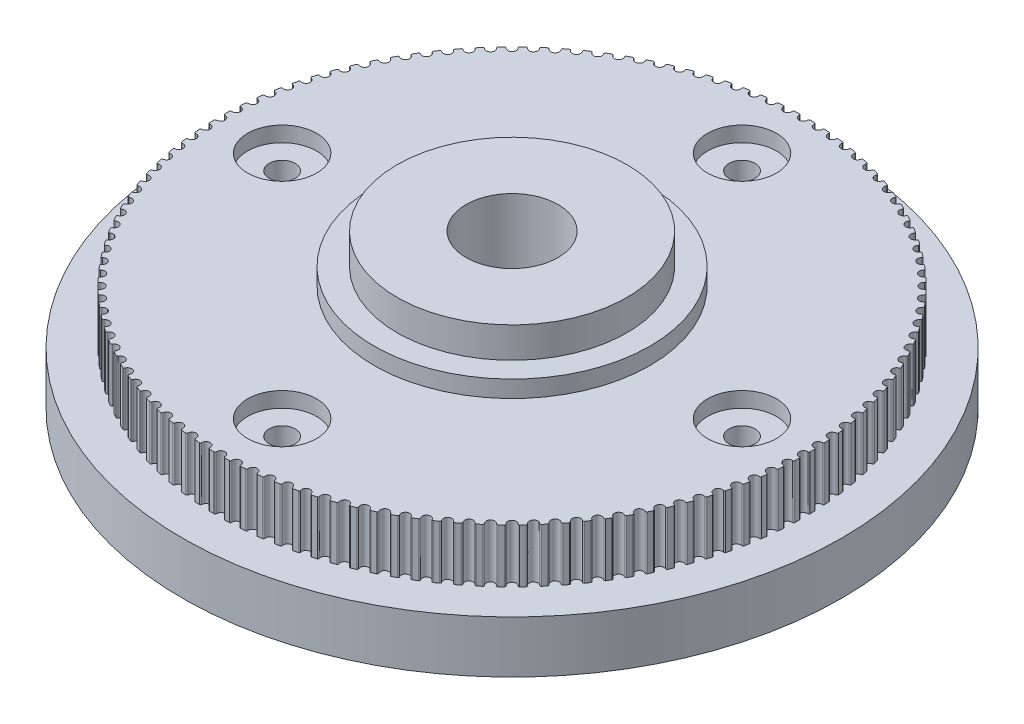
from build123d import *

# Parameters (mm, degrees)
CUT_EXTRUDE1_START      = -11
CUT_EXTRUDE1_DEPTH      = 7
SKETCH2_R               = 43
BOSS_EXTRUDE1_DEPTH     = 3
SKETCH3_R               = 43
SKETCH3_R_2             = 40
BOSS_EXTRUDE2_DEPTH     = 3.8
CUT_EXTRUDE2_DEPTH      = 63.357357224
CUT_EXTRUDE2_DEPTH_BACK = 63.357357224
SKETCH4_R               = 1.7
SKETCH10_R              = 4.5
CUT_EXTRUDE3_DEPTH      = 2
SKETCH5_R               = 18
BOSS_EXTRUDE3_DEPTH     = 2.2
SKETCH6_R               = 15
BOSS_EXTRUDE4_DEPTH     = 4
CUT_EXTRUDE4_REACH      = 66.016
SKETCH11_R              = 6


with BuildPart() as part:
    # Cut-Extrude1: read off the stored shape, not the designer's step
    # Cut-Extrude1 outline → Cut-Extrude1 (new body)
    with BuildSketch(Plane.XZ.offset(CUT_EXTRUDE1_START)):
        with BuildLine():
            ThreePointArc((-3.424251193, -37.883140987), (-3.393914308, -37.998585315), (-3.288901384, -38.055330404))
            ThreePointArc((-3.288901384, -38.055330404), (-2.9969167, -38.079437164), (-2.704755703, -38.101303666))
            ThreePointArc((-2.704755703, -38.101303666), (-2.592158775, -38.061684843), (-2.544135916, -37.952407562))
            ThreePointArc((-2.544135916, -37.952407562), (-1.960095985, -37.400859422), (-1.436907966, -38.01043492))
            ThreePointArc((-1.436907966, -38.01043492), (-1.400570768, -38.124133325), (-1.292731952, -38.175304695))
            ThreePointArc((-1.292731952, -38.175304695), (-0.999885772, -38.18409712), (-0.706980768, -38.190643129))
            ThreePointArc((-0.706980768, -38.190643129), (-0.596611639, -38.145185735), (-0.554373725, -38.033544892))
            ThreePointArc((-0.554373725, -38.033544892), (0, -37.452186342), (0.554373725, -38.033544892))
            ThreePointArc((0.554373725, -38.033544892), (0.596611639, -38.145185735), (0.706980768, -38.190643129))
            ThreePointArc((0.706980768, -38.190643129), (0.999885772, -38.18409712), (1.292731952, -38.175304695))
            ThreePointArc((1.292731952, -38.175304695), (1.400570768, -38.124133325), (1.436907966, -38.01043492))
            ThreePointArc((1.436907966, -38.01043492), (1.960095985, -37.400859422), (2.544135916, -37.952407562))
            ThreePointArc((2.544135916, -37.952407562), (2.592158775, -38.061684843), (2.704755703, -38.101303666))
            ThreePointArc((2.704755703, -38.101303666), (2.9969167, -38.079437164), (3.288901384, -38.055330404))
            ThreePointArc((3.288901384, -38.055330404), (3.393914308, -37.998585315), (3.424251193, -37.883140987))
            ThreePointArc((3.424251193, -37.883140987), (3.914819485, -37.247019347), (4.526924808, -37.76724532))
            ThreePointArc((4.526924808, -37.76724532), (4.580600984, -37.873859519), (4.695117091, -37.907531177))
            ThreePointArc((4.695117091, -37.907531177), (4.985733287, -37.870404118), (5.276056166, -37.831049097))
            ThreePointArc((5.276056166, -37.831049097), (5.377955364, -37.768885823), (5.402208784, -37.652011999))
            ThreePointArc((5.402208784, -37.652011999), (5.858812734, -36.99108778), (6.497305713, -37.478565684))
            ThreePointArc((6.497305713, -37.478565684), (6.556488084, -37.582224578), (6.672609489, -37.609856781))
            ThreePointArc((6.672609489, -37.609856781), (6.960884325, -37.557570926), (7.248749644, -37.503075514))
            ThreePointArc((7.248749644, -37.503075514), (7.347255819, -37.435664441), (7.365359297, -37.317681462))
            ThreePointArc((7.365359297, -37.317681462), (7.786747387, -36.633766213), (8.449877955, -37.087159905))
            ThreePointArc((8.449877955, -37.087159905), (8.514404306, -37.187579372), (8.631812729, -37.209096381))
            ThreePointArc((8.631812729, -37.209096381), (8.916956064, -37.141795043), (9.201574804, -37.072308609))
            ThreePointArc((9.201574804, -37.072308609), (9.296417957, -36.999834505), (9.308321873, -36.881065755))
            ThreePointArc((9.308321873, -36.881065755), (9.693339106, -36.176034039), (10.379289669, -36.594100799))
            ThreePointArc((10.379289669, -36.594100799), (10.448983138, -36.691005596), (10.567356769, -36.706348434))
            ThreePointArc((10.567356769, -36.706348434), (10.848587046, -36.624216081), (11.129179087, -36.539929082))
            ThreePointArc((11.129179087, -36.539929082), (11.220099259, -36.462590595), (11.225770984, -36.34336161))
            ThreePointArc((11.225770984, -36.34336161), (11.573362056, -35.61914587), (12.280252472, -36.000739805))
            ThreePointArc((12.280252472, -36.000739805), (12.354922033, -36.093864323), (12.47393642, -36.102990938))
            ThreePointArc((12.47393642, -36.102990938), (12.750482805, -36.006252689), (13.026279063, -35.907396149))
            ThreePointArc((13.026279063, -35.907396149), (13.113027048, -35.825405258), (13.112451038, -35.706042837))
            ThreePointArc((13.112451038, -35.706042837), (13.421663225, -34.964628098), (14.147555955, -35.308703287))
            ThreePointArc((14.147555955, -35.308703287), (14.226996946, -35.397792278), (14.346325877, -35.400677653))
            ThreePointArc((14.346325877, -35.400677653), (14.617430376, -35.289598661), (14.887674914, -35.17644354))
            ThreePointArc((14.887674914, -35.17644354), (14.970012942, -35.090024975), (14.963190776, -34.970856282))
            ThreePointArc((14.963190776, -34.970856282), (15.233176549, -34.214274712), (15.976081972, -34.519888066))
            ThreePointArc((15.976081972, -34.519888066), (16.060076649, -34.604697344), (16.179393053, -34.601333571))
            ThreePointArc((16.179393053, -34.601333571), (16.444312587, -34.476218296), (16.708264683, -34.349074744))
            ThreePointArc((16.708264683, -34.349074744), (16.785967072, -34.258465373), (16.772917447, -34.139817041))
            ThreePointArc((16.772917447, -34.139817041), (17.002936794, -33.370142376), (17.760818658, -33.636456233))
            ThreePointArc((17.760818658, -33.636456233), (17.849136798, -33.71675334), (17.968113637, -33.707149639))
            ThreePointArc((17.968113637, -33.707149639), (18.22612208, -33.568341013), (18.483058259, -33.427557521))
            ThreePointArc((18.483058259, -33.427557521), (18.555912032, -33.333005699), (18.536670717, -33.215202935))
            ThreePointArc((18.536670717, -33.215202935), (18.726093171, -32.434544799), (19.496874175, -32.66082921))
            ThreePointArc((19.496874175, -32.66082921), (19.589273704, -32.736394059), (19.70758487, -32.720576753))
            ThreePointArc((19.70758487, -32.720576753), (19.95797504, -32.568455241), (20.207191058, -32.414417687))
            ThreePointArc((20.207191058, -32.414417687), (20.274996527, -32.316182573), (20.249616262, -32.199548266))
            ThreePointArc((20.249616262, -32.199548266), (20.397922629, -31.41004639), (21.179490115, -31.595681125))
            ThreePointArc((21.179490115, -31.595681125), (21.275717772, -31.666306598), (21.393038983, -31.64431904))
            ThreePointArc((21.393038983, -31.64431904), (21.635124577, -31.479301596), (21.875937351, -31.312432187))
            ThreePointArc((21.875937351, -31.312432187), (21.938508666, -31.210783036), (21.907059015, -31.095636874))
            ThreePointArc((21.907059015, -31.095636874), (22.013842798, -30.299455227), (22.804054545, -30.443931474))
            ThreePointArc((22.804054545, -30.443931474), (22.903846576, -30.509423991), (23.019856263, -30.481326449))
            ThreePointArc((23.019856263, -30.481326449), (23.252973742, -30.303865374), (23.48472322, -30.124621487))
            ThreePointArc((23.48472322, -30.124621487), (23.541888878, -30.019836913), (23.504456043, -29.906494502))
            ThreePointArc((23.504456043, -29.906494502), (23.569424554, -29.105815363), (24.366114646, -29.208737123))
            ThreePointArc((24.366114646, -29.208737123), (24.46919753, -29.268917173), (24.583577718, -29.23478666))
            ThreePointArc((24.583577718, -29.23478666), (24.807088122, -29.045368364), (25.029139095, -28.854241294))
            ThreePointArc((25.029139095, -28.854241294), (25.080742408, -28.746608504), (25.037428991, -28.635380508))
            ThreePointArc((25.037428991, -28.635380508), (25.060404157, -27.832398483), (25.861388921, -27.893483654))
            ThreePointArc((25.861388921, -27.893483654), (25.967480113, -27.948186288), (26.079917294, -27.908116353))
            ThreePointArc((26.079917294, -27.908116353), (26.293207997, -27.707260017), (26.504951839, -27.50477363))
            ThreePointArc((26.504951839, -27.50477363), (26.550851367, -27.394587639), (26.501776086, -27.285778926))
            ThreePointArc((26.501776086, -27.285778926), (26.482694933, -26.482694933), (27.285778926, -26.501776086))
            ThreePointArc((27.285778926, -26.501776086), (27.394587639, -26.550851367), (27.50477363, -26.504951839))
            ThreePointArc((27.50477363, -26.504951839), (27.707260017, -26.293207997), (27.908116353, -26.079917294))
            ThreePointArc((27.908116353, -26.079917294), (27.948186288, -25.967480113), (27.893483654, -25.861388921))
            ThreePointArc((27.893483654, -25.861388921), (27.832398483, -25.060404157), (28.635380508, -25.037428991))
            ThreePointArc((28.635380508, -25.037428991), (28.746608504, -25.080742408), (28.854241294, -25.029139095))
            ThreePointArc((28.854241294, -25.029139095), (29.045368364, -24.807088122), (29.23478666, -24.583577718))
            ThreePointArc((29.23478666, -24.583577718), (29.268917173, -24.46919753), (29.208737123, -24.366114646))
            ThreePointArc((29.208737123, -24.366114646), (29.105815363, -23.569424554), (29.906494502, -23.504456043))
            ThreePointArc((29.906494502, -23.504456043), (30.019836913, -23.541888878), (30.124621487, -23.48472322))
            ThreePointArc((30.124621487, -23.48472322), (30.303865374, -23.252973742), (30.481326449, -23.019856263))
            ThreePointArc((30.481326449, -23.019856263), (30.509423991, -22.903846576), (30.443931474, -22.804054545))
            ThreePointArc((30.443931474, -22.804054545), (30.299455227, -22.013842798), (31.095636874, -21.907059015))
            ThreePointArc((31.095636874, -21.907059015), (31.210783036, -21.938508666), (31.312432187, -21.875937351))
            ThreePointArc((31.312432187, -21.875937351), (31.479301596, -21.635124577), (31.64431904, -21.393038983))
            ThreePointArc((31.64431904, -21.393038983), (31.666306598, -21.275717772), (31.595681125, -21.179490115))
            ThreePointArc((31.595681125, -21.179490115), (31.41004639, -20.397922629), (32.199548266, -20.249616262))
            ThreePointArc((32.199548266, -20.249616262), (32.316182573, -20.274996527), (32.414417687, -20.207191058))
            ThreePointArc((32.414417687, -20.207191058), (32.568455241, -19.95797504), (32.720576753, -19.70758487))
            ThreePointArc((32.720576753, -19.70758487), (32.736394059, -19.589273704), (32.66082921, -19.496874175))
            ThreePointArc((32.66082921, -19.496874175), (32.434544799, -18.726093171), (33.215202935, -18.536670717))
            ThreePointArc((33.215202935, -18.536670717), (33.333005699, -18.555912032), (33.427557521, -18.483058259))
            ThreePointArc((33.427557521, -18.483058259), (33.568341013, -18.22612208), (33.707149639, -17.968113637))
            ThreePointArc((33.707149639, -17.968113637), (33.71675334, -17.849136798), (33.636456233, -17.760818658))
            ThreePointArc((33.636456233, -17.760818658), (33.370142376, -17.002936794), (34.139817041, -16.772917447))
            ThreePointArc((34.139817041, -16.772917447), (34.258465373, -16.785967072), (34.349074744, -16.708264683))
            ThreePointArc((34.349074744, -16.708264683), (34.476218296, -16.444312587), (34.601333571, -16.179393053))
            ThreePointArc((34.601333571, -16.179393053), (34.604697344, -16.060076649), (34.519888066, -15.976081972))
            ThreePointArc((34.519888066, -15.976081972), (34.214274712, -15.233176549), (34.970856282, -14.963190776))
            ThreePointArc((34.970856282, -14.963190776), (35.090024975, -14.970012942), (35.17644354, -14.887674914))
            ThreePointArc((35.17644354, -14.887674914), (35.289598661, -14.617430376), (35.400677653, -14.346325877))
            ThreePointArc((35.400677653, -14.346325877), (35.397792278, -14.226996946), (35.308703287, -14.147555955))
            ThreePointArc((35.308703287, -14.147555955), (34.964628098, -13.421663225), (35.706042837, -13.112451038))
            ThreePointArc((35.706042837, -13.112451038), (35.825405258, -13.113027048), (35.907396149, -13.026279063))
            ThreePointArc((35.907396149, -13.026279063), (36.006252689, -12.750482805), (36.102990938, -12.47393642))
            ThreePointArc((36.102990938, -12.47393642), (36.093864323, -12.354922033), (36.000739805, -12.280252472))
            ThreePointArc((36.000739805, -12.280252472), (35.61914587, -11.573362056), (36.34336161, -11.225770984))
            ThreePointArc((36.34336161, -11.225770984), (36.462590595, -11.220099259), (36.539929082, -11.129179087))
            ThreePointArc((36.539929082, -11.129179087), (36.624216081, -10.848587046), (36.706348434, -10.567356769))
            ThreePointArc((36.706348434, -10.567356769), (36.691005596, -10.448983138), (36.594100799, -10.379289669))
            ThreePointArc((36.594100799, -10.379289669), (36.176034039, -9.693339106), (36.881065755, -9.308321873))
            ThreePointArc((36.881065755, -9.308321873), (36.999834505, -9.296417957), (37.072308609, -9.201574804))
            ThreePointArc((37.072308609, -9.201574804), (37.141795043, -8.916956064), (37.209096381, -8.631812729))
            ThreePointArc((37.209096381, -8.631812729), (37.187579372, -8.514404306), (37.087159905, -8.449877955))
            ThreePointArc((37.087159905, -8.449877955), (36.633766213, -7.786747387), (37.317681462, -7.365359297))
            ThreePointArc((37.317681462, -7.365359297), (37.435664441, -7.347255819), (37.503075514, -7.248749644))
            ThreePointArc((37.503075514, -7.248749644), (37.557570926, -6.960884325), (37.609856781, -6.672609489))
            ThreePointArc((37.609856781, -6.672609489), (37.582224578, -6.556488084), (37.478565684, -6.497305713))
            ThreePointArc((37.478565684, -6.497305713), (36.99108778, -5.858812734), (37.652011999, -5.402208784))
            ThreePointArc((37.652011999, -5.402208784), (37.768885823, -5.377955364), (37.831049097, -5.276056166))
            ThreePointArc((37.831049097, -5.276056166), (37.870404118, -4.985733287), (37.907531177, -4.695117091))
            ThreePointArc((37.907531177, -4.695117091), (37.873859519, -4.580600984), (37.76724532, -4.526924808))
            ThreePointArc((37.76724532, -4.526924808), (37.247019347, -3.914819485), (37.883140987, -3.424251193))
            ThreePointArc((37.883140987, -3.424251193), (37.998585315, -3.393914308), (38.055330404, -3.288901384))
            ThreePointArc((38.055330404, -3.288901384), (38.079437164, -2.9969167), (38.101303666, -2.704755703))
            ThreePointArc((38.101303666, -2.704755703), (38.061684843, -2.592158775), (37.952407562, -2.544135916))
            ThreePointArc((37.952407562, -2.544135916), (37.400859422, -1.960095985), (38.01043492, -1.436907966))
            ThreePointArc((38.01043492, -1.436907966), (38.124133325, -1.400570768), (38.175304695, -1.292731952))
            ThreePointArc((38.175304695, -1.292731952), (38.18409712, -0.999885772), (38.190643129, -0.706980768))
            ThreePointArc((38.190643129, -0.706980768), (38.145185735, -0.596611639), (38.033544892, -0.554373725))
            ThreePointArc((38.033544892, -0.554373725), (37.452186342, 0), (38.033544892, 0.554373725))
            ThreePointArc((38.033544892, 0.554373725), (38.145185735, 0.596611639), (38.190643129, 0.706980768))
            ThreePointArc((38.190643129, 0.706980768), (38.18409712, 0.999885772), (38.175304695, 1.292731952))
            ThreePointArc((38.175304695, 1.292731952), (38.124133325, 1.400570768), (38.01043492, 1.436907966))
            ThreePointArc((38.01043492, 1.436907966), (37.400859422, 1.960095985), (37.952407562, 2.544135916))
            ThreePointArc((37.952407562, 2.544135916), (38.061684843, 2.592158775), (38.101303666, 2.704755703))
            ThreePointArc((38.101303666, 2.704755703), (38.079437164, 2.9969167), (38.055330404, 3.288901384))
            ThreePointArc((38.055330404, 3.288901384), (37.998585315, 3.393914308), (37.883140987, 3.424251193))
            ThreePointArc((37.883140987, 3.424251193), (37.247019347, 3.914819485), (37.76724532, 4.526924808))
            ThreePointArc((37.76724532, 4.526924808), (37.873859519, 4.580600984), (37.907531177, 4.695117091))
            ThreePointArc((37.907531177, 4.695117091), (37.870404118, 4.985733287), (37.831049097, 5.276056166))
            ThreePointArc((37.831049097, 5.276056166), (37.768885823, 5.377955364), (37.652011999, 5.402208784))
            ThreePointArc((37.652011999, 5.402208784), (36.99108778, 5.858812734), (37.478565684, 6.497305713))
            ThreePointArc((37.478565684, 6.497305713), (37.582224578, 6.556488084), (37.609856781, 6.672609489))
            ThreePointArc((37.609856781, 6.672609489), (37.557570926, 6.960884325), (37.503075514, 7.248749644))
            ThreePointArc((37.503075514, 7.248749644), (37.435664441, 7.347255819), (37.317681462, 7.365359297))
            ThreePointArc((37.317681462, 7.365359297), (36.633766213, 7.786747387), (37.087159905, 8.449877955))
            ThreePointArc((37.087159905, 8.449877955), (37.187579372, 8.514404306), (37.209096381, 8.631812729))
            ThreePointArc((37.209096381, 8.631812729), (37.141795043, 8.916956064), (37.072308609, 9.201574804))
            ThreePointArc((37.072308609, 9.201574804), (36.999834505, 9.296417957), (36.881065755, 9.308321873))
            ThreePointArc((36.881065755, 9.308321873), (36.176034039, 9.693339106), (36.594100799, 10.379289669))
            ThreePointArc((36.594100799, 10.379289669), (36.691005596, 10.448983138), (36.706348434, 10.567356769))
            ThreePointArc((36.706348434, 10.567356769), (36.624216081, 10.848587046), (36.539929082, 11.129179087))
            ThreePointArc((36.539929082, 11.129179087), (36.462590595, 11.220099259), (36.34336161, 11.225770984))
            ThreePointArc((36.34336161, 11.225770984), (35.61914587, 11.573362056), (36.000739805, 12.280252472))
            ThreePointArc((36.000739805, 12.280252472), (36.093864323, 12.354922033), (36.102990938, 12.47393642))
            ThreePointArc((36.102990938, 12.47393642), (36.006252689, 12.750482805), (35.907396149, 13.026279063))
            ThreePointArc((35.907396149, 13.026279063), (35.825405258, 13.113027048), (35.706042837, 13.112451038))
            ThreePointArc((35.706042837, 13.112451038), (34.964628098, 13.421663225), (35.308703287, 14.147555955))
            ThreePointArc((35.308703287, 14.147555955), (35.397792278, 14.226996946), (35.400677653, 14.346325877))
            ThreePointArc((35.400677653, 14.346325877), (35.289598661, 14.617430376), (35.17644354, 14.887674914))
            ThreePointArc((35.17644354, 14.887674914), (35.090024975, 14.970012942), (34.970856282, 14.963190776))
            ThreePointArc((34.970856282, 14.963190776), (34.214274712, 15.233176549), (34.519888066, 15.976081972))
            ThreePointArc((34.519888066, 15.976081972), (34.604697344, 16.060076649), (34.601333571, 16.179393053))
            ThreePointArc((34.601333571, 16.179393053), (34.476218296, 16.444312587), (34.349074744, 16.708264683))
            ThreePointArc((34.349074744, 16.708264683), (34.258465373, 16.785967072), (34.139817041, 16.772917447))
            ThreePointArc((34.139817041, 16.772917447), (33.370142376, 17.002936794), (33.636456233, 17.760818658))
            ThreePointArc((33.636456233, 17.760818658), (33.71675334, 17.849136798), (33.707149639, 17.968113637))
            ThreePointArc((33.707149639, 17.968113637), (33.568341013, 18.22612208), (33.427557521, 18.483058259))
            ThreePointArc((33.427557521, 18.483058259), (33.333005699, 18.555912032), (33.215202935, 18.536670717))
            ThreePointArc((33.215202935, 18.536670717), (32.434544799, 18.726093171), (32.66082921, 19.496874175))
            ThreePointArc((32.66082921, 19.496874175), (32.736394059, 19.589273704), (32.720576753, 19.70758487))
            ThreePointArc((32.720576753, 19.70758487), (32.568455241, 19.95797504), (32.414417687, 20.207191058))
            ThreePointArc((32.414417687, 20.207191058), (32.316182573, 20.274996527), (32.199548266, 20.249616262))
            ThreePointArc((32.199548266, 20.249616262), (31.41004639, 20.397922629), (31.595681125, 21.179490115))
            ThreePointArc((31.595681125, 21.179490115), (31.666306598, 21.275717772), (31.64431904, 21.393038983))
            ThreePointArc((31.64431904, 21.393038983), (31.479301596, 21.635124577), (31.312432187, 21.875937351))
            ThreePointArc((31.312432187, 21.875937351), (31.210783036, 21.938508666), (31.095636874, 21.907059015))
            ThreePointArc((31.095636874, 21.907059015), (30.299455227, 22.013842798), (30.443931474, 22.804054545))
            ThreePointArc((30.443931474, 22.804054545), (30.509423991, 22.903846576), (30.481326449, 23.019856263))
            ThreePointArc((30.481326449, 23.019856263), (30.303865374, 23.252973742), (30.124621487, 23.48472322))
            ThreePointArc((30.124621487, 23.48472322), (30.019836913, 23.541888878), (29.906494502, 23.504456043))
            ThreePointArc((29.906494502, 23.504456043), (29.105815363, 23.569424554), (29.208737123, 24.366114646))
            ThreePointArc((29.208737123, 24.366114646), (29.268917173, 24.46919753), (29.23478666, 24.583577718))
            ThreePointArc((29.23478666, 24.583577718), (29.045368364, 24.807088122), (28.854241294, 25.029139095))
            ThreePointArc((28.854241294, 25.029139095), (28.746608504, 25.080742408), (28.635380508, 25.037428991))
            ThreePointArc((28.635380508, 25.037428991), (27.832398483, 25.060404157), (27.893483654, 25.861388921))
            ThreePointArc((27.893483654, 25.861388921), (27.948186288, 25.967480113), (27.908116353, 26.079917294))
            ThreePointArc((27.908116353, 26.079917294), (27.707260017, 26.293207997), (27.50477363, 26.504951839))
            ThreePointArc((27.50477363, 26.504951839), (27.394587639, 26.550851367), (27.285778926, 26.501776086))
            ThreePointArc((27.285778926, 26.501776086), (26.482694933, 26.482694933), (26.501776086, 27.285778926))
            ThreePointArc((26.501776086, 27.285778926), (26.550851367, 27.394587639), (26.504951839, 27.50477363))
            ThreePointArc((26.504951839, 27.50477363), (26.293207997, 27.707260017), (26.079917294, 27.908116353))
            ThreePointArc((26.079917294, 27.908116353), (25.967480113, 27.948186288), (25.861388921, 27.893483654))
            ThreePointArc((25.861388921, 27.893483654), (25.060404157, 27.832398483), (25.037428991, 28.635380508))
            ThreePointArc((25.037428991, 28.635380508), (25.080742408, 28.746608504), (25.029139095, 28.854241294))
            ThreePointArc((25.029139095, 28.854241294), (24.807088122, 29.045368364), (24.583577718, 29.23478666))
            ThreePointArc((24.583577718, 29.23478666), (24.46919753, 29.268917173), (24.366114646, 29.208737123))
            ThreePointArc((24.366114646, 29.208737123), (23.569424554, 29.105815363), (23.504456043, 29.906494502))
            ThreePointArc((23.504456043, 29.906494502), (23.541888878, 30.019836913), (23.48472322, 30.124621487))
            ThreePointArc((23.48472322, 30.124621487), (23.252973742, 30.303865374), (23.019856263, 30.481326449))
            ThreePointArc((23.019856263, 30.481326449), (22.903846576, 30.509423991), (22.804054545, 30.443931474))
            ThreePointArc((22.804054545, 30.443931474), (22.013842798, 30.299455227), (21.907059015, 31.095636874))
            ThreePointArc((21.907059015, 31.095636874), (21.938508666, 31.210783036), (21.875937351, 31.312432187))
            ThreePointArc((21.875937351, 31.312432187), (21.635124577, 31.479301596), (21.393038983, 31.64431904))
            ThreePointArc((21.393038983, 31.64431904), (21.275717772, 31.666306598), (21.179490115, 31.595681125))
            ThreePointArc((21.179490115, 31.595681125), (20.397922629, 31.41004639), (20.249616262, 32.199548266))
            ThreePointArc((20.249616262, 32.199548266), (20.274996527, 32.316182573), (20.207191058, 32.414417687))
            ThreePointArc((20.207191058, 32.414417687), (19.95797504, 32.568455241), (19.70758487, 32.720576753))
            ThreePointArc((19.70758487, 32.720576753), (19.589273704, 32.736394059), (19.496874175, 32.66082921))
            ThreePointArc((19.496874175, 32.66082921), (18.726093171, 32.434544799), (18.536670717, 33.215202935))
            ThreePointArc((18.536670717, 33.215202935), (18.555912032, 33.333005699), (18.483058259, 33.427557521))
            ThreePointArc((18.483058259, 33.427557521), (18.22612208, 33.568341013), (17.968113637, 33.707149639))
            ThreePointArc((17.968113637, 33.707149639), (17.849136798, 33.71675334), (17.760818658, 33.636456233))
            ThreePointArc((17.760818658, 33.636456233), (17.002936794, 33.370142376), (16.772917447, 34.139817041))
            ThreePointArc((16.772917447, 34.139817041), (16.785967072, 34.258465373), (16.708264683, 34.349074744))
            ThreePointArc((16.708264683, 34.349074744), (16.444312587, 34.476218296), (16.179393053, 34.601333571))
            ThreePointArc((16.179393053, 34.601333571), (16.060076649, 34.604697344), (15.976081972, 34.519888066))
            ThreePointArc((15.976081972, 34.519888066), (15.233176549, 34.214274712), (14.963190776, 34.970856282))
            ThreePointArc((14.963190776, 34.970856282), (14.970012942, 35.090024975), (14.887674914, 35.17644354))
            ThreePointArc((14.887674914, 35.17644354), (14.617430376, 35.289598661), (14.346325877, 35.400677653))
            ThreePointArc((14.346325877, 35.400677653), (14.226996946, 35.397792278), (14.147555955, 35.308703287))
            ThreePointArc((14.147555955, 35.308703287), (13.421663225, 34.964628098), (13.112451038, 35.706042837))
            ThreePointArc((13.112451038, 35.706042837), (13.113027048, 35.825405258), (13.026279063, 35.907396149))
            ThreePointArc((13.026279063, 35.907396149), (12.750482805, 36.006252689), (12.47393642, 36.102990938))
            ThreePointArc((12.47393642, 36.102990938), (12.354922033, 36.093864323), (12.280252472, 36.000739805))
            ThreePointArc((12.280252472, 36.000739805), (11.573362056, 35.61914587), (11.225770984, 36.34336161))
            ThreePointArc((11.225770984, 36.34336161), (11.220099259, 36.462590595), (11.129179087, 36.539929082))
            ThreePointArc((11.129179087, 36.539929082), (10.848587046, 36.624216081), (10.567356769, 36.706348434))
            ThreePointArc((10.567356769, 36.706348434), (10.448983138, 36.691005596), (10.379289669, 36.594100799))
            ThreePointArc((10.379289669, 36.594100799), (9.693339106, 36.176034039), (9.308321873, 36.881065755))
            ThreePointArc((9.308321873, 36.881065755), (9.296417957, 36.999834505), (9.201574804, 37.072308609))
            ThreePointArc((9.201574804, 37.072308609), (8.916956064, 37.141795043), (8.631812729, 37.209096381))
            ThreePointArc((8.631812729, 37.209096381), (8.514404306, 37.187579372), (8.449877955, 37.087159905))
            ThreePointArc((8.449877955, 37.087159905), (7.786747387, 36.633766213), (7.365359297, 37.317681462))
            ThreePointArc((7.365359297, 37.317681462), (7.347255819, 37.435664441), (7.248749644, 37.503075514))
            ThreePointArc((7.248749644, 37.503075514), (6.960884325, 37.557570926), (6.672609489, 37.609856781))
            ThreePointArc((6.672609489, 37.609856781), (6.556488084, 37.582224578), (6.497305713, 37.478565684))
            ThreePointArc((6.497305713, 37.478565684), (5.858812734, 36.99108778), (5.402208784, 37.652011999))
            ThreePointArc((5.402208784, 37.652011999), (5.377955364, 37.768885823), (5.276056166, 37.831049097))
            ThreePointArc((5.276056166, 37.831049097), (4.985733287, 37.870404118), (4.695117091, 37.907531177))
            ThreePointArc((4.695117091, 37.907531177), (4.580600984, 37.873859519), (4.526924808, 37.76724532))
            ThreePointArc((4.526924808, 37.76724532), (3.914819485, 37.247019347), (3.424251193, 37.883140987))
            ThreePointArc((3.424251193, 37.883140987), (3.393914308, 37.998585315), (3.288901384, 38.055330404))
            ThreePointArc((3.288901384, 38.055330404), (2.9969167, 38.079437164), (2.704755703, 38.101303666))
            ThreePointArc((2.704755703, 38.101303666), (2.592158775, 38.061684843), (2.544135916, 37.952407562))
            ThreePointArc((2.544135916, 37.952407562), (1.960095985, 37.400859422), (1.436907966, 38.01043492))
            ThreePointArc((1.436907966, 38.01043492), (1.400570768, 38.124133325), (1.292731952, 38.175304695))
            ThreePointArc((1.292731952, 38.175304695), (0.999885772, 38.18409712), (0.706980768, 38.190643129))
            ThreePointArc((0.706980768, 38.190643129), (0.596611639, 38.145185735), (0.554373725, 38.033544892))
            ThreePointArc((0.554373725, 38.033544892), (0, 37.452186342), (-0.554373725, 38.033544892))
            ThreePointArc((-0.554373725, 38.033544892), (-0.596611639, 38.145185735), (-0.706980768, 38.190643129))
            ThreePointArc((-0.706980768, 38.190643129), (-0.999885772, 38.18409712), (-1.292731952, 38.175304695))
            ThreePointArc((-1.292731952, 38.175304695), (-1.400570768, 38.124133325), (-1.436907966, 38.01043492))
            ThreePointArc((-1.436907966, 38.01043492), (-1.960095985, 37.400859422), (-2.544135916, 37.952407562))
            ThreePointArc((-2.544135916, 37.952407562), (-2.592158775, 38.061684843), (-2.704755703, 38.101303666))
            ThreePointArc((-2.704755703, 38.101303666), (-2.9969167, 38.079437164), (-3.288901384, 38.055330404))
            ThreePointArc((-3.288901384, 38.055330404), (-3.393914308, 37.998585315), (-3.424251193, 37.883140987))
            ThreePointArc((-3.424251193, 37.883140987), (-3.914819485, 37.247019347), (-4.526924808, 37.76724532))
            ThreePointArc((-4.526924808, 37.76724532), (-4.580600984, 37.873859519), (-4.695117091, 37.907531177))
            ThreePointArc((-4.695117091, 37.907531177), (-4.985733287, 37.870404118), (-5.276056166, 37.831049097))
            ThreePointArc((-5.276056166, 37.831049097), (-5.377955364, 37.768885823), (-5.402208784, 37.652011999))
            ThreePointArc((-5.402208784, 37.652011999), (-5.858812734, 36.99108778), (-6.497305713, 37.478565684))
            ThreePointArc((-6.497305713, 37.478565684), (-6.556488084, 37.582224578), (-6.672609489, 37.609856781))
            ThreePointArc((-6.672609489, 37.609856781), (-6.960884325, 37.557570926), (-7.248749644, 37.503075514))
            ThreePointArc((-7.248749644, 37.503075514), (-7.347255819, 37.435664441), (-7.365359297, 37.317681462))
            ThreePointArc((-7.365359297, 37.317681462), (-7.786747387, 36.633766213), (-8.449877955, 37.087159905))
            ThreePointArc((-8.449877955, 37.087159905), (-8.514404306, 37.187579372), (-8.631812729, 37.209096381))
            ThreePointArc((-8.631812729, 37.209096381), (-8.916956064, 37.141795043), (-9.201574804, 37.072308609))
            ThreePointArc((-9.201574804, 37.072308609), (-9.296417957, 36.999834505), (-9.308321873, 36.881065755))
            ThreePointArc((-9.308321873, 36.881065755), (-9.693339106, 36.176034039), (-10.379289669, 36.594100799))
            ThreePointArc((-10.379289669, 36.594100799), (-10.448983138, 36.691005596), (-10.567356769, 36.706348434))
            ThreePointArc((-10.567356769, 36.706348434), (-10.848587046, 36.624216081), (-11.129179087, 36.539929082))
            ThreePointArc((-11.129179087, 36.539929082), (-11.220099259, 36.462590595), (-11.225770984, 36.34336161))
            ThreePointArc((-11.225770984, 36.34336161), (-11.573362056, 35.61914587), (-12.280252472, 36.000739805))
            ThreePointArc((-12.280252472, 36.000739805), (-12.354922033, 36.093864323), (-12.47393642, 36.102990938))
            ThreePointArc((-12.47393642, 36.102990938), (-12.750482805, 36.006252689), (-13.026279063, 35.907396149))
            ThreePointArc((-13.026279063, 35.907396149), (-13.113027048, 35.825405258), (-13.112451038, 35.706042837))
            ThreePointArc((-13.112451038, 35.706042837), (-13.421663225, 34.964628098), (-14.147555955, 35.308703287))
            ThreePointArc((-14.147555955, 35.308703287), (-14.226996946, 35.397792278), (-14.346325877, 35.400677653))
            ThreePointArc((-14.346325877, 35.400677653), (-14.617430376, 35.289598661), (-14.887674914, 35.17644354))
            ThreePointArc((-14.887674914, 35.17644354), (-14.970012942, 35.090024975), (-14.963190776, 34.970856282))
            ThreePointArc((-14.963190776, 34.970856282), (-15.233176549, 34.214274712), (-15.976081972, 34.519888066))
            ThreePointArc((-15.976081972, 34.519888066), (-16.060076649, 34.604697344), (-16.179393053, 34.601333571))
            ThreePointArc((-16.179393053, 34.601333571), (-16.444312587, 34.476218296), (-16.708264683, 34.349074744))
            ThreePointArc((-16.708264683, 34.349074744), (-16.785967072, 34.258465373), (-16.772917447, 34.139817041))
            ThreePointArc((-16.772917447, 34.139817041), (-17.002936794, 33.370142376), (-17.760818658, 33.636456233))
            ThreePointArc((-17.760818658, 33.636456233), (-17.849136798, 33.71675334), (-17.968113637, 33.707149639))
            ThreePointArc((-17.968113637, 33.707149639), (-18.22612208, 33.568341013), (-18.483058259, 33.427557521))
            ThreePointArc((-18.483058259, 33.427557521), (-18.555912032, 33.333005699), (-18.536670717, 33.215202935))
            ThreePointArc((-18.536670717, 33.215202935), (-18.726093171, 32.434544799), (-19.496874175, 32.66082921))
            ThreePointArc((-19.496874175, 32.66082921), (-19.589273704, 32.736394059), (-19.70758487, 32.720576753))
            ThreePointArc((-19.70758487, 32.720576753), (-19.95797504, 32.568455241), (-20.207191058, 32.414417687))
            ThreePointArc((-20.207191058, 32.414417687), (-20.274996527, 32.316182573), (-20.249616262, 32.199548266))
            ThreePointArc((-20.249616262, 32.199548266), (-20.397922629, 31.41004639), (-21.179490115, 31.595681125))
            ThreePointArc((-21.179490115, 31.595681125), (-21.275717772, 31.666306598), (-21.393038983, 31.64431904))
            ThreePointArc((-21.393038983, 31.64431904), (-21.635124577, 31.479301596), (-21.875937351, 31.312432187))
            ThreePointArc((-21.875937351, 31.312432187), (-21.938508666, 31.210783036), (-21.907059015, 31.095636874))
            ThreePointArc((-21.907059015, 31.095636874), (-22.013842798, 30.299455227), (-22.804054545, 30.443931474))
            ThreePointArc((-22.804054545, 30.443931474), (-22.903846576, 30.509423991), (-23.019856263, 30.481326449))
            ThreePointArc((-23.019856263, 30.481326449), (-23.252973742, 30.303865374), (-23.48472322, 30.124621487))
            ThreePointArc((-23.48472322, 30.124621487), (-23.541888878, 30.019836913), (-23.504456043, 29.906494502))
            ThreePointArc((-23.504456043, 29.906494502), (-23.569424554, 29.105815363), (-24.366114646, 29.208737123))
            ThreePointArc((-24.366114646, 29.208737123), (-24.46919753, 29.268917173), (-24.583577718, 29.23478666))
            ThreePointArc((-24.583577718, 29.23478666), (-24.807088122, 29.045368364), (-25.029139095, 28.854241294))
            ThreePointArc((-25.029139095, 28.854241294), (-25.080742408, 28.746608504), (-25.037428991, 28.635380508))
            ThreePointArc((-25.037428991, 28.635380508), (-25.060404157, 27.832398483), (-25.861388921, 27.893483654))
            ThreePointArc((-25.861388921, 27.893483654), (-25.967480113, 27.948186288), (-26.079917294, 27.908116353))
            ThreePointArc((-26.079917294, 27.908116353), (-26.293207997, 27.707260017), (-26.504951839, 27.50477363))
            ThreePointArc((-26.504951839, 27.50477363), (-26.550851367, 27.394587639), (-26.501776086, 27.285778926))
            ThreePointArc((-26.501776086, 27.285778926), (-26.482694933, 26.482694933), (-27.285778926, 26.501776086))
            ThreePointArc((-27.285778926, 26.501776086), (-27.394587639, 26.550851367), (-27.50477363, 26.504951839))
            ThreePointArc((-27.50477363, 26.504951839), (-27.707260017, 26.293207997), (-27.908116353, 26.079917294))
            ThreePointArc((-27.908116353, 26.079917294), (-27.948186288, 25.967480113), (-27.893483654, 25.861388921))
            ThreePointArc((-27.893483654, 25.861388921), (-27.832398483, 25.060404157), (-28.635380508, 25.037428991))
            ThreePointArc((-28.635380508, 25.037428991), (-28.746608504, 25.080742408), (-28.854241294, 25.029139095))
            ThreePointArc((-28.854241294, 25.029139095), (-29.045368364, 24.807088122), (-29.23478666, 24.583577718))
            ThreePointArc((-29.23478666, 24.583577718), (-29.268917173, 24.46919753), (-29.208737123, 24.366114646))
            ThreePointArc((-29.208737123, 24.366114646), (-29.105815363, 23.569424554), (-29.906494502, 23.504456043))
            ThreePointArc((-29.906494502, 23.504456043), (-30.019836913, 23.541888878), (-30.124621487, 23.48472322))
            ThreePointArc((-30.124621487, 23.48472322), (-30.303865374, 23.252973742), (-30.481326449, 23.019856263))
            ThreePointArc((-30.481326449, 23.019856263), (-30.509423991, 22.903846576), (-30.443931474, 22.804054545))
            ThreePointArc((-30.443931474, 22.804054545), (-30.299455227, 22.013842798), (-31.095636874, 21.907059015))
            ThreePointArc((-31.095636874, 21.907059015), (-31.210783036, 21.938508666), (-31.312432187, 21.875937351))
            ThreePointArc((-31.312432187, 21.875937351), (-31.479301596, 21.635124577), (-31.64431904, 21.393038983))
            ThreePointArc((-31.64431904, 21.393038983), (-31.666306598, 21.275717772), (-31.595681125, 21.179490115))
            ThreePointArc((-31.595681125, 21.179490115), (-31.41004639, 20.397922629), (-32.199548266, 20.249616262))
            ThreePointArc((-32.199548266, 20.249616262), (-32.316182573, 20.274996527), (-32.414417687, 20.207191058))
            ThreePointArc((-32.414417687, 20.207191058), (-32.568455241, 19.95797504), (-32.720576753, 19.70758487))
            ThreePointArc((-32.720576753, 19.70758487), (-32.736394059, 19.589273704), (-32.66082921, 19.496874175))
            ThreePointArc((-32.66082921, 19.496874175), (-32.434544799, 18.726093171), (-33.215202935, 18.536670717))
            ThreePointArc((-33.215202935, 18.536670717), (-33.333005699, 18.555912032), (-33.427557521, 18.483058259))
            ThreePointArc((-33.427557521, 18.483058259), (-33.568341013, 18.22612208), (-33.707149639, 17.968113637))
            ThreePointArc((-33.707149639, 17.968113637), (-33.71675334, 17.849136798), (-33.636456233, 17.760818658))
            ThreePointArc((-33.636456233, 17.760818658), (-33.370142376, 17.002936794), (-34.139817041, 16.772917447))
            ThreePointArc((-34.139817041, 16.772917447), (-34.258465373, 16.785967072), (-34.349074744, 16.708264683))
            ThreePointArc((-34.349074744, 16.708264683), (-34.476218296, 16.444312587), (-34.601333571, 16.179393053))
            ThreePointArc((-34.601333571, 16.179393053), (-34.604697344, 16.060076649), (-34.519888066, 15.976081972))
            ThreePointArc((-34.519888066, 15.976081972), (-34.214274712, 15.233176549), (-34.970856282, 14.963190776))
            ThreePointArc((-34.970856282, 14.963190776), (-35.090024975, 14.970012942), (-35.17644354, 14.887674914))
            ThreePointArc((-35.17644354, 14.887674914), (-35.289598661, 14.617430376), (-35.400677653, 14.346325877))
            ThreePointArc((-35.400677653, 14.346325877), (-35.397792278, 14.226996946), (-35.308703287, 14.147555955))
            ThreePointArc((-35.308703287, 14.147555955), (-34.964628098, 13.421663225), (-35.706042837, 13.112451038))
            ThreePointArc((-35.706042837, 13.112451038), (-35.825405258, 13.113027048), (-35.907396149, 13.026279063))
            ThreePointArc((-35.907396149, 13.026279063), (-36.006252689, 12.750482805), (-36.102990938, 12.47393642))
            ThreePointArc((-36.102990938, 12.47393642), (-36.093864323, 12.354922033), (-36.000739805, 12.280252472))
            ThreePointArc((-36.000739805, 12.280252472), (-35.61914587, 11.573362056), (-36.34336161, 11.225770984))
            ThreePointArc((-36.34336161, 11.225770984), (-36.462590595, 11.220099259), (-36.539929082, 11.129179087))
            ThreePointArc((-36.539929082, 11.129179087), (-36.624216081, 10.848587046), (-36.706348434, 10.567356769))
            ThreePointArc((-36.706348434, 10.567356769), (-36.691005596, 10.448983138), (-36.594100799, 10.379289669))
            ThreePointArc((-36.594100799, 10.379289669), (-36.176034039, 9.693339106), (-36.881065755, 9.308321873))
            ThreePointArc((-36.881065755, 9.308321873), (-36.999834505, 9.296417957), (-37.072308609, 9.201574804))
            ThreePointArc((-37.072308609, 9.201574804), (-37.141795043, 8.916956064), (-37.209096381, 8.631812729))
            ThreePointArc((-37.209096381, 8.631812729), (-37.187579372, 8.514404306), (-37.087159905, 8.449877955))
            ThreePointArc((-37.087159905, 8.449877955), (-36.633766213, 7.786747387), (-37.317681462, 7.365359297))
            ThreePointArc((-37.317681462, 7.365359297), (-37.435664441, 7.347255819), (-37.503075514, 7.248749644))
            ThreePointArc((-37.503075514, 7.248749644), (-37.557570926, 6.960884325), (-37.609856781, 6.672609489))
            ThreePointArc((-37.609856781, 6.672609489), (-37.582224578, 6.556488084), (-37.478565684, 6.497305713))
            ThreePointArc((-37.478565684, 6.497305713), (-36.99108778, 5.858812734), (-37.652011999, 5.402208784))
            ThreePointArc((-37.652011999, 5.402208784), (-37.768885823, 5.377955364), (-37.831049097, 5.276056166))
            ThreePointArc((-37.831049097, 5.276056166), (-37.870404118, 4.985733287), (-37.907531177, 4.695117091))
            ThreePointArc((-37.907531177, 4.695117091), (-37.873859519, 4.580600984), (-37.76724532, 4.526924808))
            ThreePointArc((-37.76724532, 4.526924808), (-37.247019347, 3.914819485), (-37.883140987, 3.424251193))
            ThreePointArc((-37.883140987, 3.424251193), (-37.998585315, 3.393914308), (-38.055330404, 3.288901384))
            ThreePointArc((-38.055330404, 3.288901384), (-38.079437164, 2.9969167), (-38.101303666, 2.704755703))
            ThreePointArc((-38.101303666, 2.704755703), (-38.061684843, 2.592158775), (-37.952407562, 2.544135916))
            ThreePointArc((-37.952407562, 2.544135916), (-37.400859422, 1.960095985), (-38.01043492, 1.436907966))
            ThreePointArc((-38.01043492, 1.436907966), (-38.124133325, 1.400570768), (-38.175304695, 1.292731952))
            ThreePointArc((-38.175304695, 1.292731952), (-38.18409712, 0.999885772), (-38.190643129, 0.706980768))
            ThreePointArc((-38.190643129, 0.706980768), (-38.145185735, 0.596611639), (-38.033544892, 0.554373725))
            ThreePointArc((-38.033544892, 0.554373725), (-37.452186342, 0), (-38.033544892, -0.554373725))
            ThreePointArc((-38.033544892, -0.554373725), (-38.145185735, -0.596611639), (-38.190643129, -0.706980768))
            ThreePointArc((-38.190643129, -0.706980768), (-38.18409712, -0.999885772), (-38.175304695, -1.292731952))
            ThreePointArc((-38.175304695, -1.292731952), (-38.124133325, -1.400570768), (-38.01043492, -1.436907966))
            ThreePointArc((-38.01043492, -1.436907966), (-37.400859422, -1.960095985), (-37.952407562, -2.544135916))
            ThreePointArc((-37.952407562, -2.544135916), (-38.061684843, -2.592158775), (-38.101303666, -2.704755703))
            ThreePointArc((-38.101303666, -2.704755703), (-38.079437164, -2.9969167), (-38.055330404, -3.288901384))
            ThreePointArc((-38.055330404, -3.288901384), (-37.998585315, -3.393914308), (-37.883140987, -3.424251193))
            ThreePointArc((-37.883140987, -3.424251193), (-37.247019347, -3.914819485), (-37.76724532, -4.526924808))
            ThreePointArc((-37.76724532, -4.526924808), (-37.873859519, -4.580600984), (-37.907531177, -4.695117091))
            ThreePointArc((-37.907531177, -4.695117091), (-37.870404118, -4.985733287), (-37.831049097, -5.276056166))
            ThreePointArc((-37.831049097, -5.276056166), (-37.768885823, -5.377955364), (-37.652011999, -5.402208784))
            ThreePointArc((-37.652011999, -5.402208784), (-36.99108778, -5.858812734), (-37.478565684, -6.497305713))
            ThreePointArc((-37.478565684, -6.497305713), (-37.582224578, -6.556488084), (-37.609856781, -6.672609489))
            ThreePointArc((-37.609856781, -6.672609489), (-37.557570926, -6.960884325), (-37.503075514, -7.248749644))
            ThreePointArc((-37.503075514, -7.248749644), (-37.435664441, -7.347255819), (-37.317681462, -7.365359297))
            ThreePointArc((-37.317681462, -7.365359297), (-36.633766213, -7.786747387), (-37.087159905, -8.449877955))
            ThreePointArc((-37.087159905, -8.449877955), (-37.187579372, -8.514404306), (-37.209096381, -8.631812729))
            ThreePointArc((-37.209096381, -8.631812729), (-37.141795043, -8.916956064), (-37.072308609, -9.201574804))
            ThreePointArc((-37.072308609, -9.201574804), (-36.999834505, -9.296417957), (-36.881065755, -9.308321873))
            ThreePointArc((-36.881065755, -9.308321873), (-36.176034039, -9.693339106), (-36.594100799, -10.379289669))
            ThreePointArc((-36.594100799, -10.379289669), (-36.691005596, -10.448983138), (-36.706348434, -10.567356769))
            ThreePointArc((-36.706348434, -10.567356769), (-36.624216081, -10.848587046), (-36.539929082, -11.129179087))
            ThreePointArc((-36.539929082, -11.129179087), (-36.462590595, -11.220099259), (-36.34336161, -11.225770984))
            ThreePointArc((-36.34336161, -11.225770984), (-35.61914587, -11.573362056), (-36.000739805, -12.280252472))
            ThreePointArc((-36.000739805, -12.280252472), (-36.093864323, -12.354922033), (-36.102990938, -12.47393642))
            ThreePointArc((-36.102990938, -12.47393642), (-36.006252689, -12.750482805), (-35.907396149, -13.026279063))
            ThreePointArc((-35.907396149, -13.026279063), (-35.825405258, -13.113027048), (-35.706042837, -13.112451038))
            ThreePointArc((-35.706042837, -13.112451038), (-34.964628098, -13.421663225), (-35.308703287, -14.147555955))
            ThreePointArc((-35.308703287, -14.147555955), (-35.397792278, -14.226996946), (-35.400677653, -14.346325877))
            ThreePointArc((-35.400677653, -14.346325877), (-35.289598661, -14.617430376), (-35.17644354, -14.887674914))
            ThreePointArc((-35.17644354, -14.887674914), (-35.090024975, -14.970012942), (-34.970856282, -14.963190776))
            ThreePointArc((-34.970856282, -14.963190776), (-34.214274712, -15.233176549), (-34.519888066, -15.976081972))
            ThreePointArc((-34.519888066, -15.976081972), (-34.604697344, -16.060076649), (-34.601333571, -16.179393053))
            ThreePointArc((-34.601333571, -16.179393053), (-34.476218296, -16.444312587), (-34.349074744, -16.708264683))
            ThreePointArc((-34.349074744, -16.708264683), (-34.258465373, -16.785967072), (-34.139817041, -16.772917447))
            ThreePointArc((-34.139817041, -16.772917447), (-33.370142376, -17.002936794), (-33.636456233, -17.760818658))
            ThreePointArc((-33.636456233, -17.760818658), (-33.71675334, -17.849136798), (-33.707149639, -17.968113637))
            ThreePointArc((-33.707149639, -17.968113637), (-33.568341013, -18.22612208), (-33.427557521, -18.483058259))
            ThreePointArc((-33.427557521, -18.483058259), (-33.333005699, -18.555912032), (-33.215202935, -18.536670717))
            ThreePointArc((-33.215202935, -18.536670717), (-32.434544799, -18.726093171), (-32.66082921, -19.496874175))
            ThreePointArc((-32.66082921, -19.496874175), (-32.736394059, -19.589273704), (-32.720576753, -19.70758487))
            ThreePointArc((-32.720576753, -19.70758487), (-32.568455241, -19.95797504), (-32.414417687, -20.207191058))
            ThreePointArc((-32.414417687, -20.207191058), (-32.316182573, -20.274996527), (-32.199548266, -20.249616262))
            ThreePointArc((-32.199548266, -20.249616262), (-31.41004639, -20.397922629), (-31.595681125, -21.179490115))
            ThreePointArc((-31.595681125, -21.179490115), (-31.666306598, -21.275717772), (-31.64431904, -21.393038983))
            ThreePointArc((-31.64431904, -21.393038983), (-31.479301596, -21.635124577), (-31.312432187, -21.875937351))
            ThreePointArc((-31.312432187, -21.875937351), (-31.210783036, -21.938508666), (-31.095636874, -21.907059015))
            ThreePointArc((-31.095636874, -21.907059015), (-30.299455227, -22.013842798), (-30.443931474, -22.804054545))
            ThreePointArc((-30.443931474, -22.804054545), (-30.509423991, -22.903846576), (-30.481326449, -23.019856263))
            ThreePointArc((-30.481326449, -23.019856263), (-30.303865374, -23.252973742), (-30.124621487, -23.48472322))
            ThreePointArc((-30.124621487, -23.48472322), (-30.019836913, -23.541888878), (-29.906494502, -23.504456043))
            ThreePointArc((-29.906494502, -23.504456043), (-29.105815363, -23.569424554), (-29.208737123, -24.366114646))
            ThreePointArc((-29.208737123, -24.366114646), (-29.268917173, -24.46919753), (-29.23478666, -24.583577718))
            ThreePointArc((-29.23478666, -24.583577718), (-29.045368364, -24.807088122), (-28.854241294, -25.029139095))
            ThreePointArc((-28.854241294, -25.029139095), (-28.746608504, -25.080742408), (-28.635380508, -25.037428991))
            ThreePointArc((-28.635380508, -25.037428991), (-27.832398483, -25.060404157), (-27.893483654, -25.861388921))
            ThreePointArc((-27.893483654, -25.861388921), (-27.948186288, -25.967480113), (-27.908116353, -26.079917294))
            ThreePointArc((-27.908116353, -26.079917294), (-27.707260017, -26.293207997), (-27.50477363, -26.504951839))
            ThreePointArc((-27.50477363, -26.504951839), (-27.394587639, -26.550851367), (-27.285778926, -26.501776086))
            ThreePointArc((-27.285778926, -26.501776086), (-26.482694933, -26.482694933), (-26.501776086, -27.285778926))
            ThreePointArc((-26.501776086, -27.285778926), (-26.550851367, -27.394587639), (-26.504951839, -27.50477363))
            ThreePointArc((-26.504951839, -27.50477363), (-26.293207997, -27.707260017), (-26.079917294, -27.908116353))
            ThreePointArc((-26.079917294, -27.908116353), (-25.967480113, -27.948186288), (-25.861388921, -27.893483654))
            ThreePointArc((-25.861388921, -27.893483654), (-25.060404157, -27.832398483), (-25.037428991, -28.635380508))
            ThreePointArc((-25.037428991, -28.635380508), (-25.080742408, -28.746608504), (-25.029139095, -28.854241294))
            ThreePointArc((-25.029139095, -28.854241294), (-24.807088122, -29.045368364), (-24.583577718, -29.23478666))
            ThreePointArc((-24.583577718, -29.23478666), (-24.46919753, -29.268917173), (-24.366114646, -29.208737123))
            ThreePointArc((-24.366114646, -29.208737123), (-23.569424554, -29.105815363), (-23.504456043, -29.906494502))
            ThreePointArc((-23.504456043, -29.906494502), (-23.541888878, -30.019836913), (-23.48472322, -30.124621487))
            ThreePointArc((-23.48472322, -30.124621487), (-23.252973742, -30.303865374), (-23.019856263, -30.481326449))
            ThreePointArc((-23.019856263, -30.481326449), (-22.903846576, -30.509423991), (-22.804054545, -30.443931474))
            ThreePointArc((-22.804054545, -30.443931474), (-22.013842798, -30.299455227), (-21.907059015, -31.095636874))
            ThreePointArc((-21.907059015, -31.095636874), (-21.938508666, -31.210783036), (-21.875937351, -31.312432187))
            ThreePointArc((-21.875937351, -31.312432187), (-21.635124577, -31.479301596), (-21.393038983, -31.64431904))
            ThreePointArc((-21.393038983, -31.64431904), (-21.275717772, -31.666306598), (-21.179490115, -31.595681125))
            ThreePointArc((-21.179490115, -31.595681125), (-20.397922629, -31.41004639), (-20.249616262, -32.199548266))
            ThreePointArc((-20.249616262, -32.199548266), (-20.274996527, -32.316182573), (-20.207191058, -32.414417687))
            ThreePointArc((-20.207191058, -32.414417687), (-19.95797504, -32.568455241), (-19.70758487, -32.720576753))
            ThreePointArc((-19.70758487, -32.720576753), (-19.589273704, -32.736394059), (-19.496874175, -32.66082921))
            ThreePointArc((-19.496874175, -32.66082921), (-18.726093171, -32.434544799), (-18.536670717, -33.215202935))
            ThreePointArc((-18.536670717, -33.215202935), (-18.555912032, -33.333005699), (-18.483058259, -33.427557521))
            ThreePointArc((-18.483058259, -33.427557521), (-18.22612208, -33.568341013), (-17.968113637, -33.707149639))
            ThreePointArc((-17.968113637, -33.707149639), (-17.849136798, -33.71675334), (-17.760818658, -33.636456233))
            ThreePointArc((-17.760818658, -33.636456233), (-17.002936794, -33.370142376), (-16.772917447, -34.139817041))
            ThreePointArc((-16.772917447, -34.139817041), (-16.785967072, -34.258465373), (-16.708264683, -34.349074744))
            ThreePointArc((-16.708264683, -34.349074744), (-16.444312587, -34.476218296), (-16.179393053, -34.601333571))
            ThreePointArc((-16.179393053, -34.601333571), (-16.060076649, -34.604697344), (-15.976081972, -34.519888066))
            ThreePointArc((-15.976081972, -34.519888066), (-15.233176549, -34.214274712), (-14.963190776, -34.970856282))
            ThreePointArc((-14.963190776, -34.970856282), (-14.970012942, -35.090024975), (-14.887674914, -35.17644354))
            ThreePointArc((-14.887674914, -35.17644354), (-14.617430376, -35.289598661), (-14.346325877, -35.400677653))
            ThreePointArc((-14.346325877, -35.400677653), (-14.226996946, -35.397792278), (-14.147555955, -35.308703287))
            ThreePointArc((-14.147555955, -35.308703287), (-13.421663225, -34.964628098), (-13.112451038, -35.706042837))
            ThreePointArc((-13.112451038, -35.706042837), (-13.113027048, -35.825405258), (-13.026279063, -35.907396149))
            ThreePointArc((-13.026279063, -35.907396149), (-12.750482805, -36.006252689), (-12.47393642, -36.102990938))
            ThreePointArc((-12.47393642, -36.102990938), (-12.354922033, -36.093864323), (-12.280252472, -36.000739805))
            ThreePointArc((-12.280252472, -36.000739805), (-11.573362056, -35.61914587), (-11.225770984, -36.34336161))
            ThreePointArc((-11.225770984, -36.34336161), (-11.220099259, -36.462590595), (-11.129179087, -36.539929082))
            ThreePointArc((-11.129179087, -36.539929082), (-10.848587046, -36.624216081), (-10.567356769, -36.706348434))
            ThreePointArc((-10.567356769, -36.706348434), (-10.448983138, -36.691005596), (-10.379289669, -36.594100799))
            ThreePointArc((-10.379289669, -36.594100799), (-9.693339106, -36.176034039), (-9.308321873, -36.881065755))
            ThreePointArc((-9.308321873, -36.881065755), (-9.296417957, -36.999834505), (-9.201574804, -37.072308609))
            ThreePointArc((-9.201574804, -37.072308609), (-8.916956064, -37.141795043), (-8.631812729, -37.209096381))
            ThreePointArc((-8.631812729, -37.209096381), (-8.514404306, -37.187579372), (-8.449877955, -37.087159905))
            ThreePointArc((-8.449877955, -37.087159905), (-7.786747387, -36.633766213), (-7.365359297, -37.317681462))
            ThreePointArc((-7.365359297, -37.317681462), (-7.347255819, -37.435664441), (-7.248749644, -37.503075514))
            ThreePointArc((-7.248749644, -37.503075514), (-6.960884325, -37.557570926), (-6.672609489, -37.609856781))
            ThreePointArc((-6.672609489, -37.609856781), (-6.556488084, -37.582224578), (-6.497305713, -37.478565684))
            ThreePointArc((-6.497305713, -37.478565684), (-5.858812734, -36.99108778), (-5.402208784, -37.652011999))
            ThreePointArc((-5.402208784, -37.652011999), (-5.377955364, -37.768885823), (-5.276056166, -37.831049097))
            ThreePointArc((-5.276056166, -37.831049097), (-4.985733287, -37.870404118), (-4.695117091, -37.907531177))
            ThreePointArc((-4.695117091, -37.907531177), (-4.580600984, -37.873859519), (-4.526924808, -37.76724532))
            ThreePointArc((-4.526924808, -37.76724532), (-3.914819485, -37.247019347), (-3.424251193, -37.883140987))
        make_face()
    extrude(amount=CUT_EXTRUDE1_DEPTH)

    # Sketch2 → Boss-Extrude1 (add)
    with BuildSketch(Plane.XZ.offset(-4)):
        Circle(SKETCH2_R)
    extrude(amount=BOSS_EXTRUDE1_DEPTH)

    # Sketch3 → Boss-Extrude2 (add)
    with BuildSketch(Plane.XZ.offset(-1)):
        Circle(SKETCH3_R)
        with Locations(Location((0, 0, 0), (0, 0, 180))):
            Circle(SKETCH3_R_2, mode=Mode.SUBTRACT)
    extrude(amount=BOSS_EXTRUDE2_DEPTH)

    # Sketch4 → Cut-Extrude2 (cut, two sides: drawn at the far end of the back side and taken through both)
    with BuildSketch(Plane(origin=(0, 11, 0), x_dir=(1, 0, 0), z_dir=(0, 1, 0)).offset(-CUT_EXTRUDE2_DEPTH_BACK)):
        with Locations((0, 30)):
            Circle(SKETCH4_R)
        with Locations((30, 0)):
            Circle(SKETCH4_R)
        with Locations((0, -30)):
            Circle(SKETCH4_R)
        with Locations((-30, 0)):
            Circle(SKETCH4_R)
    extrude(amount=CUT_EXTRUDE2_DEPTH + CUT_EXTRUDE2_DEPTH_BACK, mode=Mode.SUBTRACT)

    # Sketch10 → Cut-Extrude3 (cut)
    with BuildSketch(Plane(origin=(0, 11, 0), x_dir=(1, 0, 0), z_dir=(0, 1, 0))):
        with Locations(Location((-30, 0, 0), (0, 0, 180))):
            Circle(SKETCH10_R)
        with Locations(Location((0, 30, 0), (0, 0, 180))):
            Circle(SKETCH10_R)
        with Locations(Location((30, 0, 0), (0, 0, 180))):
            Circle(SKETCH10_R)
        with Locations(Location((0, -30, 0), (0, 0, 180))):
            Circle(SKETCH10_R)
    extrude(amount=-CUT_EXTRUDE3_DEPTH, mode=Mode.SUBTRACT)

    # Sketch5 → Boss-Extrude3 (add)
    with BuildSketch(Plane(origin=(0, 11, 0), x_dir=(1, 0, 0), z_dir=(0, 1, 0))):
        Circle(SKETCH5_R)
    extrude(amount=BOSS_EXTRUDE3_DEPTH)

    # Sketch6 → Boss-Extrude4 (add)
    with BuildSketch(Plane(origin=(0, 13.2, 0), x_dir=(1, 0, 0), z_dir=(0, 1, 0))):
        with Locations(Location((0, 0, 0), (0, 0, 180))):
            Circle(SKETCH6_R)
    extrude(amount=BOSS_EXTRUDE4_DEPTH)

    # Sketch11 → Cut-Extrude4 (cut, up to next)
    with BuildSketch(Plane(origin=(0, 17.2, 0), x_dir=(1, 0, 0), z_dir=(0, 1, 0)), mode=Mode.PRIVATE) as cut_extrude4_sk1:
        with Locations(Location((0, 0, 0), (0, 0, 180))):
            Circle(SKETCH11_R)
    cut_extrude4_tool1 = extrude(cut_extrude4_sk1.sketch, amount=-CUT_EXTRUDE4_REACH, mode=Mode.PRIVATE) & part.part
    add(cut_extrude4_tool1.solids().sort_by_distance((0, 17.2, 0))[0], mode=Mode.SUBTRACT)


solid = part.part
